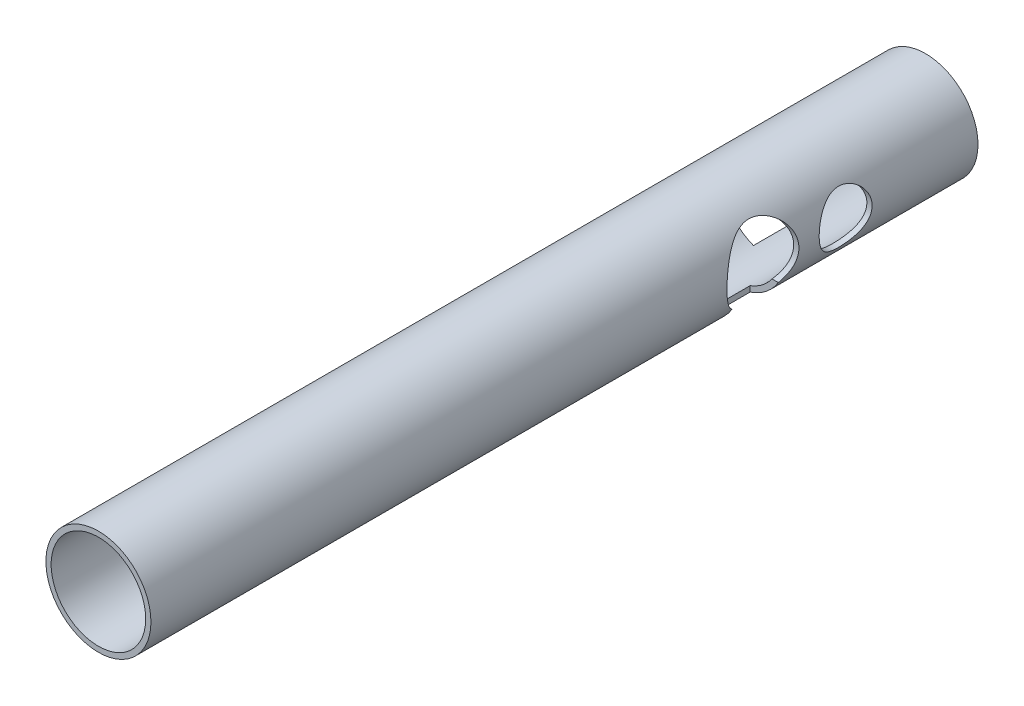
from build123d import *

# Parameters (mm, degrees)
BOSS_EXTRUDE1_DEPTH      = 250
BOSS_EXTRUDE1_DEPTH_BACK = 250
SKETCH1_R                = 31.75
SKETCH1_R_2              = 28.575
SKETCH2_R                = 21.75
SKETCH2_R_2              = 16
CUT_EXTRUDE1_DEPTH       = 255.000246063
SKETCH3_R                = 16
SKETCH3_R_2              = 21.75
CUT_EXTRUDE2_DEPTH       = 255.000246186
CUT_EXTRUDE3_START       = 10
SKETCH4_W                = 28
SKETCH4_H                = 22
CUT_EXTRUDE3_DEPTH       = 20
CUT_EXTRUDE4_START       = -10
SKETCH5_W                = 28
SKETCH5_H                = 22
CUT_EXTRUDE4_DEPTH       = 20


with BuildPart() as part:
    # Sketch1 → Boss-Extrude1 (new, two sides: drawn at the far end of the back side and taken through both)
    with BuildSketch(Plane.XY.offset(-BOSS_EXTRUDE1_DEPTH_BACK)):
        Circle(SKETCH1_R)
        Circle(SKETCH1_R_2, mode=Mode.SUBTRACT)
    extrude(amount=BOSS_EXTRUDE1_DEPTH + BOSS_EXTRUDE1_DEPTH_BACK)

    # Sketch2 → Cut-Extrude1 (cut, through all)
    with BuildSketch(Plane(origin=(0, 0, 0), x_dir=(0, 0, -1), z_dir=(1, 0, 0))):
        with Locations((170, 0)):
            Circle(SKETCH2_R)
        with Locations((120, 0)):
            Circle(SKETCH2_R_2)
    extrude(amount=-CUT_EXTRUDE1_DEPTH, mode=Mode.SUBTRACT)

    # Sketch3 → Cut-Extrude2 (cut, through all)
    with BuildSketch(Plane(origin=(0, 0, 0), x_dir=(0, 0, -1), z_dir=(1, 0, 0))):
        with Locations((170, 0)):
            Circle(SKETCH3_R)
        with Locations((120, 0)):
            Circle(SKETCH3_R_2)
    extrude(amount=CUT_EXTRUDE2_DEPTH, mode=Mode.SUBTRACT)

    # Sketch4 → Cut-Extrude3 (cut)
    with BuildSketch(Plane(origin=(0, 0, 0), x_dir=(0, 0, -1), z_dir=(1, 0, 0)).offset(CUT_EXTRUDE3_START)):
        with Locations((120, -21.75)):
            Rectangle(SKETCH4_W, SKETCH4_H)
    extrude(amount=CUT_EXTRUDE3_DEPTH, mode=Mode.SUBTRACT)

    # Sketch5 → Cut-Extrude4 (cut)
    with BuildSketch(Plane(origin=(0, 0, 0), x_dir=(0, 0, -1), z_dir=(1, 0, 0)).offset(CUT_EXTRUDE4_START)):
        with Locations((170, -21.75)):
            Rectangle(SKETCH5_W, SKETCH5_H)
    extrude(amount=-CUT_EXTRUDE4_DEPTH, mode=Mode.SUBTRACT)


solid = part.part
